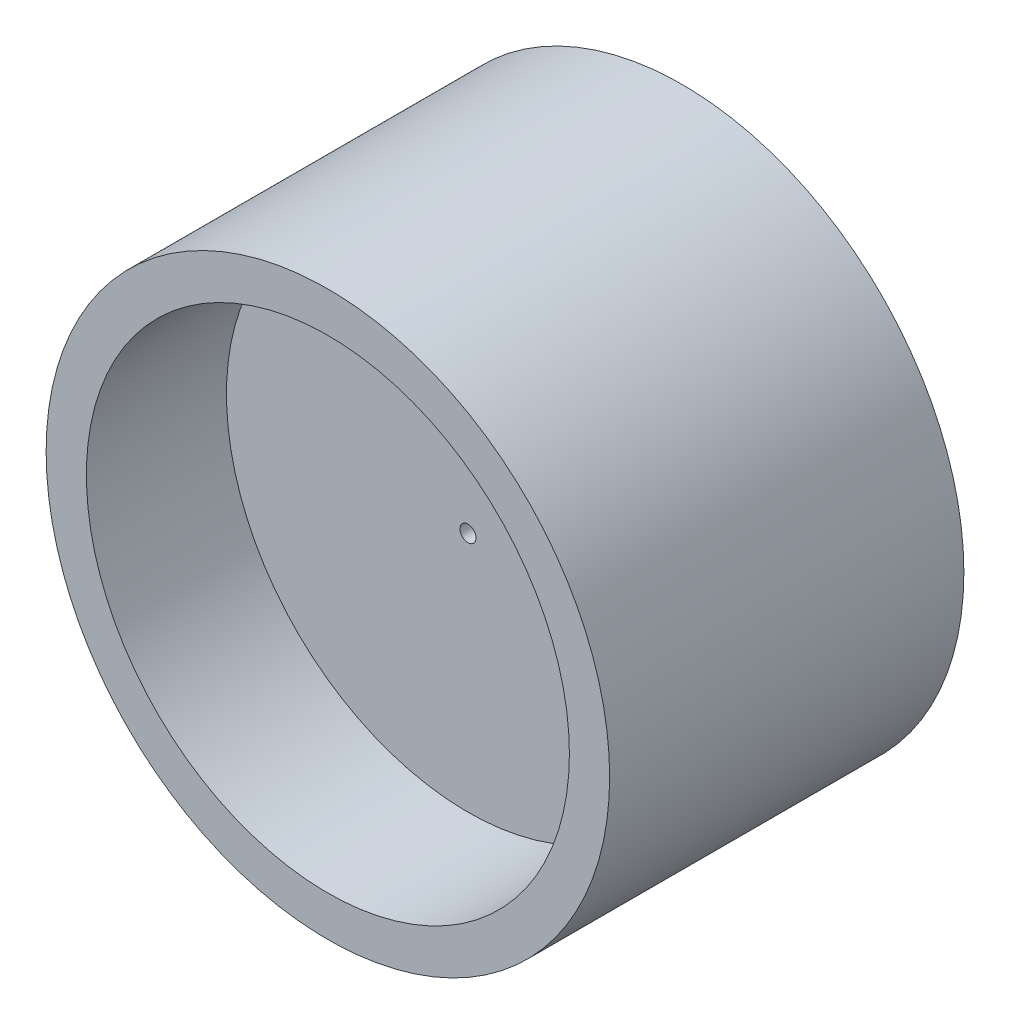
from build123d import *

# Parameters (mm, degrees)
SKETCH1_R           = 44.45
BOSS_EXTRUDE1_DEPTH = 55.88
SKETCH2_R           = 38.1
CUT_EXTRUDE1_DEPTH  = 22.098
CUT_EXTRUDE2_START  = -28.575
SKETCH3_R           = 38.1
CUT_EXTRUDE2_DEPTH  = 28.575
SKETCH4_R           = 1.27
CUT_EXTRUDE3_DEPTH  = 72.364056247


with BuildPart() as part:
    # Sketch1 → Boss-Extrude1 (new body)
    with BuildSketch(Plane.XY):
        Circle(SKETCH1_R)
    extrude(amount=BOSS_EXTRUDE1_DEPTH)

    # Sketch2 → Cut-Extrude1 (cut)
    with BuildSketch(Plane.XY.offset(55.88)):
        Circle(SKETCH2_R)
    extrude(amount=-CUT_EXTRUDE1_DEPTH, mode=Mode.SUBTRACT)

    # Sketch3 → Cut-Extrude2 (cut)
    with BuildSketch(Plane(origin=(0, 0, 0), x_dir=(-1, 0, 0), z_dir=(0, 0, -1)).offset(CUT_EXTRUDE2_START)):
        Circle(SKETCH3_R)
    extrude(amount=CUT_EXTRUDE2_DEPTH, mode=Mode.SUBTRACT)

    # Sketch4 → Cut-Extrude3 (cut, through all)
    with BuildSketch(Plane.XY.offset(33.782)):
        Circle(SKETCH4_R)
    extrude(amount=-CUT_EXTRUDE3_DEPTH, mode=Mode.SUBTRACT)


solid = part.part
